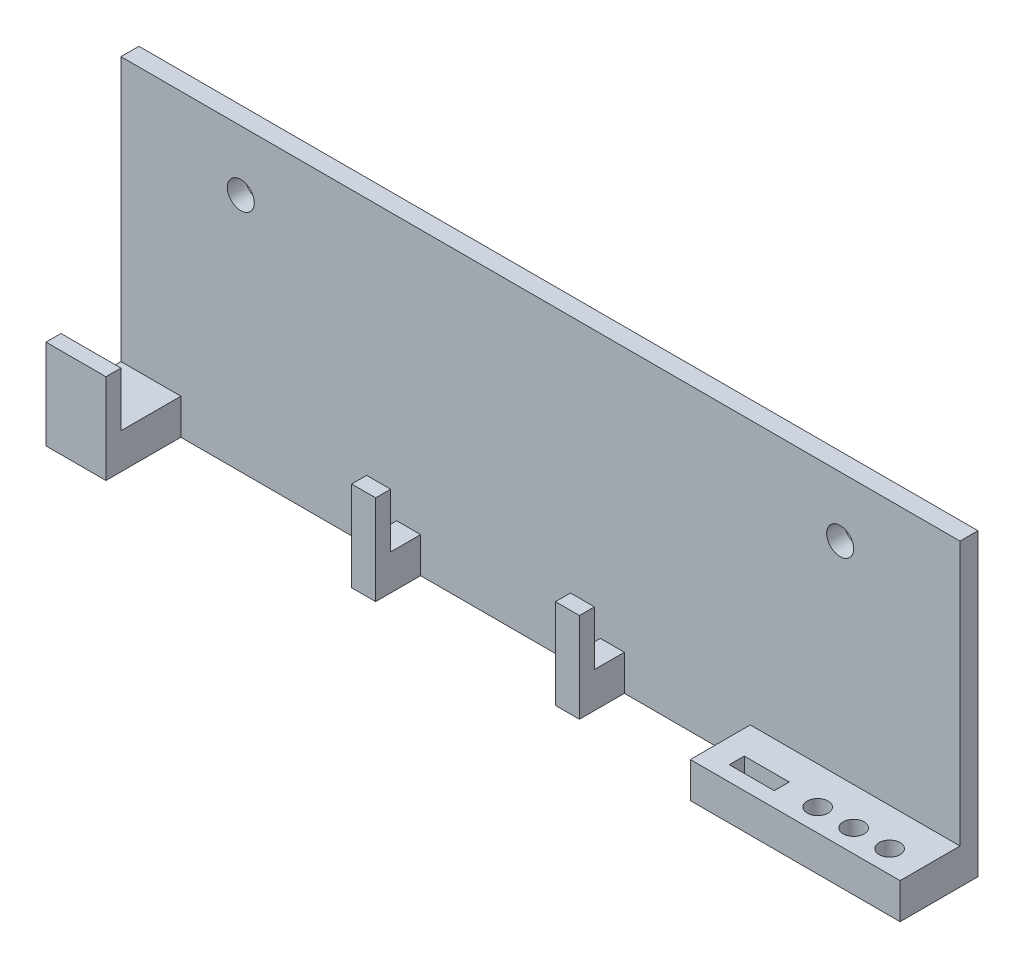
from build123d import *

# Parameters (mm, degrees)
SKETCH1_W           = 3
SKETCH1_H           = 50
BOSS_EXTRUDE1_DEPTH = 140
SKETCH3_W           = 10
SKETCH3_H           = 5.940571325
SKETCH3_W_2         = 4
SKETCH3_W_3         = 35
BOSS_EXTRUDE2_DEPTH = 10
SKETCH5_W           = 38
SKETCH5_H           = 5
CUT_EXTRUDE2_DEPTH  = 15
SKETCH6_W           = 10
SKETCH6_H           = 2.5
SKETCH6_W_2         = 4
BOSS_EXTRUDE4_DEPTH = 15
SKETCH7_R           = 1.75
SKETCH7_W           = 7.5
SKETCH7_H           = 2.5
CUT_EXTRUDE3_DEPTH  = 15
SKETCH8_R           = 2.25
CUT_EXTRUDE4_DEPTH  = 15


with BuildPart() as part:
    # Sketch1 → Boss-Extrude1 (new body)
    with BuildSketch(Plane(origin=(0, 0, 0), x_dir=(0, 0, -1), z_dir=(1, 0, 0))):
        with Locations((1.5, -8)):
            Rectangle(SKETCH1_W, SKETCH1_H)
    extrude(amount=BOSS_EXTRUDE1_DEPTH)

    # Sketch3 → Boss-Extrude2 (add)
    with BuildSketch(Plane.XY):
        with Locations((5, -30.029714338)):
            Rectangle(SKETCH3_W, SKETCH3_H)
        with Locations((48, -30.029714338)):
            Rectangle(SKETCH3_W_2, SKETCH3_H)
        with Locations((82, -30.029714338)):
            Rectangle(SKETCH3_W_2, SKETCH3_H)
        with Locations((122.5, -30.029714338)):
            Rectangle(SKETCH3_W_3, SKETCH3_H)
    extrude(amount=BOSS_EXTRUDE2_DEPTH)

    # Sketch5 → Cut-Extrude2 (cut)
    with BuildSketch(Plane.XZ.offset(33)):
        with Locations((65, 7.5)):
            Rectangle(SKETCH5_W, SKETCH5_H)
    extrude(amount=-CUT_EXTRUDE2_DEPTH, mode=Mode.SUBTRACT)

    # Sketch6 → Boss-Extrude4 (add)
    with BuildSketch(Plane.XZ.offset(33)):
        with Locations((5, 11.25)):
            Rectangle(SKETCH6_W, SKETCH6_H)
        with Locations((48, 6.25)):
            Rectangle(SKETCH6_W_2, SKETCH6_H)
        with Locations((82, 6.25)):
            Rectangle(SKETCH6_W_2, SKETCH6_H)
    extrude(amount=-BOSS_EXTRUDE4_DEPTH)

    # Sketch7 → Cut-Extrude3 (cut)
    with BuildSketch(Plane(origin=(0, -27.059428675, 0), x_dir=(1, 0, 0), z_dir=(0, 1, 0))):
        with Locations((128.5, -6.25)):
            Circle(SKETCH7_R)
        with Locations((122.5, -6.25)):
            Circle(SKETCH7_R)
        with Locations((134.5, -6.25)):
            Circle(SKETCH7_R)
        with Locations((112.75, -6.25)):
            Rectangle(SKETCH7_W, SKETCH7_H)
    extrude(amount=-CUT_EXTRUDE3_DEPTH, mode=Mode.SUBTRACT)

    # Sketch8 → Cut-Extrude4 (cut)
    with BuildSketch(Plane.XY):
        with Locations((20, 7)):
            Circle(SKETCH8_R)
        with Locations((120, 7)):
            Circle(SKETCH8_R)
    extrude(amount=-CUT_EXTRUDE4_DEPTH, mode=Mode.SUBTRACT)


solid = part.part
